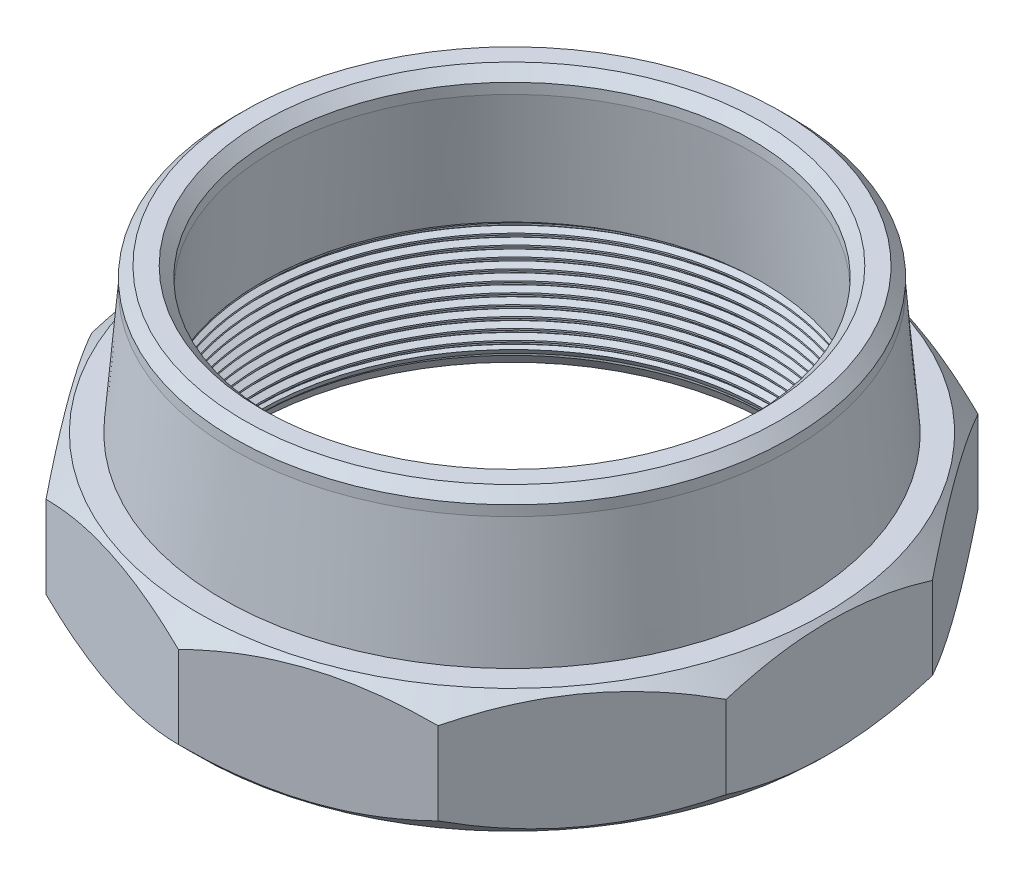
from build123d import *

# Parameters (mm, degrees)
SKETCH_2_OUTSIDE_W  = 85.752
SKETCH_2_OUTSIDE_H  = 85.752
CUT_EXTRUDE_3_DEPTH = 42
CHAMFER_1_SIZE      = 2
CHAMFER_1_SIZE2     = 1
CHAMFER_2_SIZE      = 1
SWEEP_1_PITCH       = 1
SWEEP_1_FROM        = 0
CHAMFER_3_SIZE      = 1


with BuildPart() as part:
    # Эскиз1 → Повернуть1 (revolve)
    with BuildSketch(Plane.XY, mode=Mode.PRIVATE) as revolve_1_sk:
        Polygon((24.36, -12), (24.36, 0.6), (24.2, 0.6), (23.2, 12.030052303), (23.2, 14.04467911), (27, 14.04467911), (27, 12.04467911), (28, 0), (30.36, 0), (32.36, -2), (32.36, -10), (30.36, -12), (29.354380547, -12), align=None)
    revolve(revolve_1_sk.sketch.rotate(Axis((0, 9.050704291, 0), (0, -1, 0)), 180), axis=Axis((0, 9.050704291, 0), (0, -1, 0)))

    # Эскиз2 outside → Вырез-Вытянуть3 (cut)
    with BuildSketch(Plane(origin=(0, 0, 0), x_dir=(1, 0, 0), z_dir=(0, 1, 0))):
        Rectangle(SKETCH_2_OUTSIDE_W, SKETCH_2_OUTSIDE_H)
        Polygon((0, 32.36), (-19.020730764, 26.179789938), (-30.776188867, 9.999789938), (-30.776188867, -9.999789938), (-19.020730764, -26.179789938), (0, -32.36), (19.020730764, -26.179789938), (30.776188867, -9.999789938), (30.776188867, 9.999789938), (19.020730764, 26.179789938), align=None, mode=Mode.SUBTRACT)
    extrude(amount=-CUT_EXTRUDE_3_DEPTH, mode=Mode.SUBTRACT)

    # Фаска1
    chamfer_1_edges = [part.edges().sort_by_distance(p)[0] for p in [
        (24.36, -12, 0),
    ]]
    chamfer_1_side = [part.faces().sort_by_distance(p)[0] for p in [
        (24.36, -5.7, 0),
    ]]
    chamfer(chamfer_1_edges, length=CHAMFER_1_SIZE, length2=CHAMFER_1_SIZE2, reference=chamfer_1_side[0])

    # Фаска2
    chamfer_2_edges = [part.edges().sort_by_distance(p)[0] for p in [
        (27, 14.04467911, 0),
    ]]
    chamfer(chamfer_2_edges, length=CHAMFER_2_SIZE)

    # Вырез-По траектории1: arcs per turn and ends read off the stored shape
    # Вырез-По траектории1: the profile of Эскиз4 screwed along a left-hand helix through 20.5 turns, 8 arcs to a turn; built about Z, then put on its axis
    sweep_1_z = Axis((0, 0, 0), (0, 0, 1))
    sweep_1_corners = [(24.36, 0, -1.425), (24.879615242, 0, -1.125), (24.909615242, 0, -1.125), (24.909615242, 0, -0.875), (24.879615242, 0, -0.875), (24.36, 0, -0.575), (24.26, 0, -0.517264973), (24.26, 0, -1.482735027)]
    with BuildLine(mode=Mode.PRIVATE) as sweep_1_profile:
        Line(sweep_1_corners[0], sweep_1_corners[1])
        Line(sweep_1_corners[1], sweep_1_corners[2])
        Line(sweep_1_corners[2], sweep_1_corners[3])
        Line(sweep_1_corners[3], sweep_1_corners[4])
        Line(sweep_1_corners[4], sweep_1_corners[5])
        Line(sweep_1_corners[5], sweep_1_corners[6])
        Line(sweep_1_corners[6], sweep_1_corners[7])
        Line(sweep_1_corners[7], sweep_1_corners[0])
    sweep_1_cap = Face(sweep_1_profile.wire())
    sweep_1_turn_angles = [0, -22.5, -45, -67.5, -90, -112.5, -135, -157.5, -180, -202.5, -225, -247.5, -270, -292.5, -315, -337.5, -360]
    sweep_1_turn_weights = [1, 0.9238795325112867, 1, 0.9238795325112867, 1, 0.9238795325112867, 1, 0.9238795325112867, 1, 0.9238795325112867, 1, 0.9238795325112867, 1, 0.9238795325112867, 1, 0.9238795325112867, 1]
    sweep_1_turn_rails = [Edge.make_bspline([Vector(p[0], p[1], 0).rotate(sweep_1_z, sweep_1_turn_angles[k]) / sweep_1_turn_weights[k] + Vector(0, 0, p[2] + -SWEEP_1_PITCH * sweep_1_turn_angles[k] / 360) for k in range(17)], [0, 0, 0, 1, 1, 2, 2, 3, 3, 4, 4, 5, 5, 6, 6, 7, 7, 8, 8, 8], 2, sweep_1_turn_weights) for p in sweep_1_corners]
    sweep_1_turn_sides = [Face.make_surface_from_curves(sweep_1_turn_rails[p[0]], sweep_1_turn_rails[p[1]]) for p in [(0, 1), (1, 2), (2, 3), (3, 4), (4, 5), (5, 6), (6, 7), (7, 0)]]
    sweep_1_last_angles = [-7200, -7222.5, -7245, -7267.5, -7290, -7312.5, -7335, -7357.5, -7380]
    sweep_1_last_weights = [1, 0.9238795325112867, 1, 0.9238795325112867, 1, 0.9238795325112867, 1, 0.9238795325112867, 1]
    sweep_1_last_rails = [Edge.make_bspline([Vector(p[0], p[1], 0).rotate(sweep_1_z, sweep_1_last_angles[k]) / sweep_1_last_weights[k] + Vector(0, 0, p[2] + -SWEEP_1_PITCH * sweep_1_last_angles[k] / 360) for k in range(9)], [0, 0, 0, 1, 1, 2, 2, 3, 3, 4, 4, 4], 2, sweep_1_last_weights) for p in sweep_1_corners]
    sweep_1_last_sides = [Face.make_surface_from_curves(sweep_1_last_rails[p[0]], sweep_1_last_rails[p[1]]) for p in [(0, 1), (1, 2), (2, 3), (3, 4), (4, 5), (5, 6), (6, 7), (7, 0)]]
    sweep_1 = Plane(origin=(0, 0.6, 0), x_dir=(0, 0, 1), z_dir=(0, -1, 0)) * split(Solid(Shell([*[p.moved(Location((0, 0, SWEEP_1_PITCH * i))) for i in range(20) for p in sweep_1_turn_sides], *sweep_1_last_sides, sweep_1_cap, sweep_1_cap.rotate(sweep_1_z, -7380).moved(Location((0, 0, -SWEEP_1_PITCH * -7380 / 360)))])), bisect_by=Plane.XY.offset(SWEEP_1_FROM), keep=Keep.TOP, mode=Mode.PRIVATE)
    add(sweep_1, mode=Mode.SUBTRACT)

    # Фаска3
    chamfer_3_edges = [part.edges().sort_by_distance(p)[0] for p in [
        (23.2, 14.04467911, 0),
    ]]
    chamfer(chamfer_3_edges, length=CHAMFER_3_SIZE)


solid = part.part
